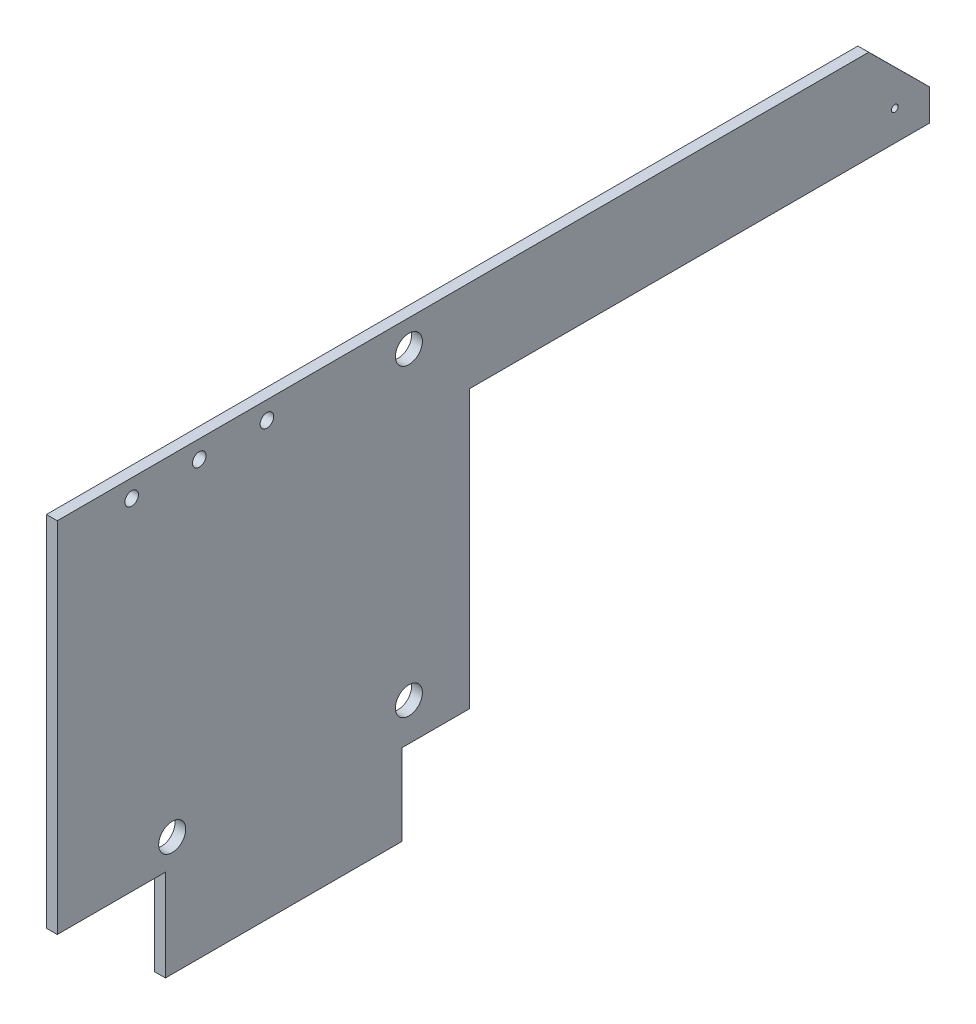
from build123d import *

# Parameters (mm, degrees)
SKETCH1_R           = 2
SKETCH1_R_2         = 1
SKETCH1_R_3         = 0.5
BOSS_EXTRUDE1_DEPTH = 1.6


with BuildPart() as part:
    # Sketch1 → Boss-Extrude1 (new body)
    with BuildSketch(Plane(origin=(0, 0, 0), x_dir=(0, 0, -1), z_dir=(1, 0, 0))):
        Polygon((3, 11), (3, 64), (123, 64), (132, 55.063430305), (132, 50.423430305), (64, 50.423430305), (64, 9.436073979), (54, 9.436073979), (54, -2.563926021), (19, -2.563926021), (19, 11), align=None)
        with Locations((20, 15)):
            Circle(SKETCH1_R, mode=Mode.SUBTRACT)
        with Locations((55, 15)):
            Circle(SKETCH1_R, mode=Mode.SUBTRACT)
        with Locations((55, 60)):
            Circle(SKETCH1_R, mode=Mode.SUBTRACT)
        with Locations((14, 61.35)):
            Circle(SKETCH1_R_2, mode=Mode.SUBTRACT)
        with Locations((24, 61.35)):
            Circle(SKETCH1_R_2, mode=Mode.SUBTRACT)
        with Locations((34, 61.35)):
            Circle(SKETCH1_R_2, mode=Mode.SUBTRACT)
        with Locations((126.861808856, 54.882900864)):
            Circle(SKETCH1_R_3, mode=Mode.SUBTRACT)
    extrude(amount=BOSS_EXTRUDE1_DEPTH)


solid = part.part
